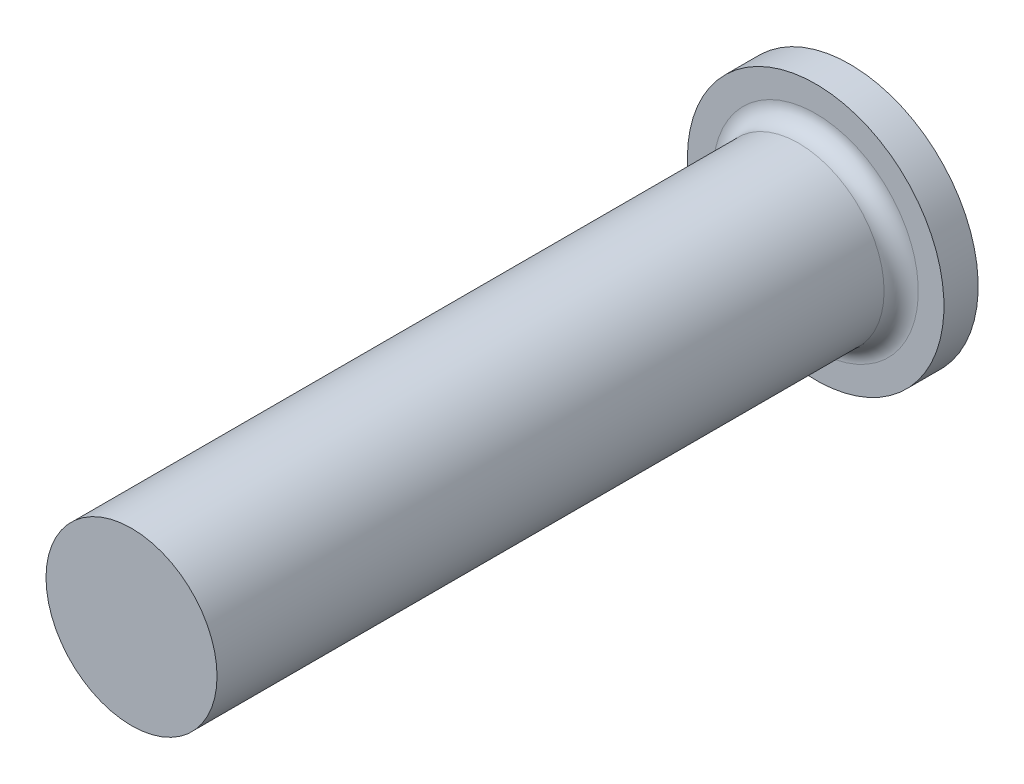
from build123d import *

# Parameters (mm, degrees)
CROQUIS1_R     = 5
BARRAS_DEPTH   = 40
CROQUIS2_R     = 7.5
SUJECI_N_DEPTH = 2
REDONDEO1_R    = 1


with BuildPart() as part:
    # Croquis1 → Barras (new body)
    with BuildSketch(Plane.XY):
        Circle(CROQUIS1_R)
    extrude(amount=BARRAS_DEPTH)

    # Croquis2 → Sujeción (add)
    with BuildSketch(Plane(origin=(0, 0, 0), x_dir=(-1, 0, 0), z_dir=(0, 0, -1))):
        Circle(CROQUIS2_R)
    extrude(amount=SUJECI_N_DEPTH)

    # Redondeo1
    redondeo1_edges = [part.edges().sort_by_distance(p)[0] for p in [
        (-5, 0, 0),
    ]]
    fillet(redondeo1_edges, radius=REDONDEO1_R)


solid = part.part
